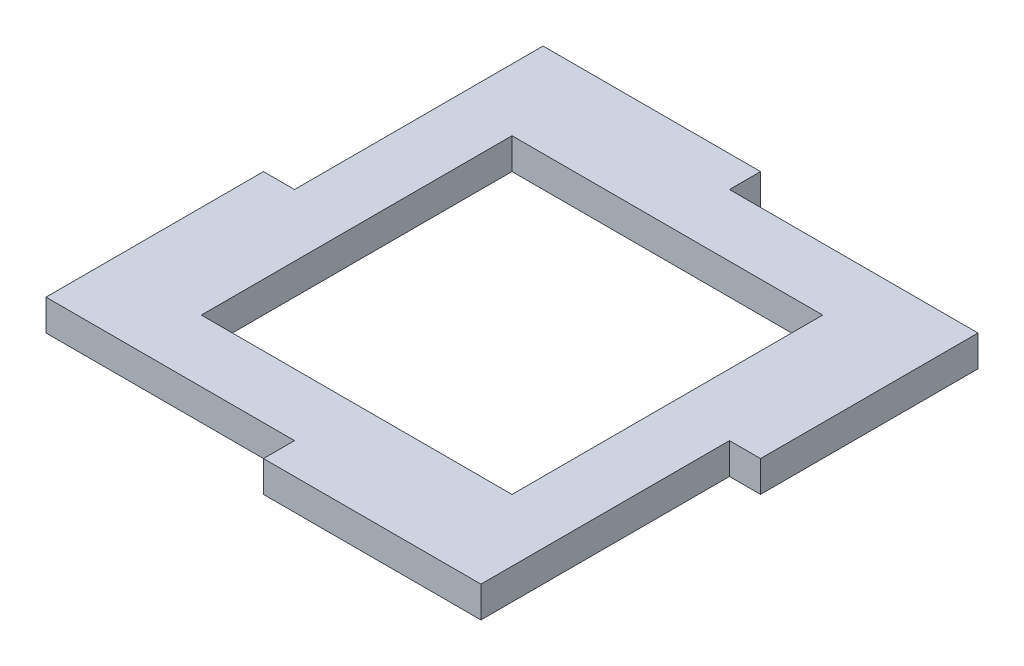
from build123d import *

# Parameters (mm, degrees)
SKETCH1_W           = 127
SKETCH1_H           = 127
BOSS_EXTRUDE1_DEPTH = 12.7


with BuildPart() as part:
    # Sketch1 → Boss-Extrude1 (new body)
    with BuildSketch(Plane(origin=(0, 0, 0), x_dir=(1, 0, 0), z_dir=(0, 1, 0))):
        Polygon((-112.506214689, 106.012711864), (-112.506214689, 4.412711864), (-125.206214689, 4.412711864), (-125.206214689, -84.487288136), (-23.606214689, -84.487288136), (-23.606214689, -97.187288136), (65.293785311, -97.187288136), (65.293785311, 4.412711864), (77.993785311, 4.412711864), (77.993785311, 93.312711864), (-23.606214689, 93.312711864), (-23.606214689, 106.012711864), align=None)
        with Locations((-23.606214689, 4.412711864)):
            Rectangle(SKETCH1_W, SKETCH1_H, mode=Mode.SUBTRACT)
    extrude(amount=BOSS_EXTRUDE1_DEPTH)


solid = part.part
